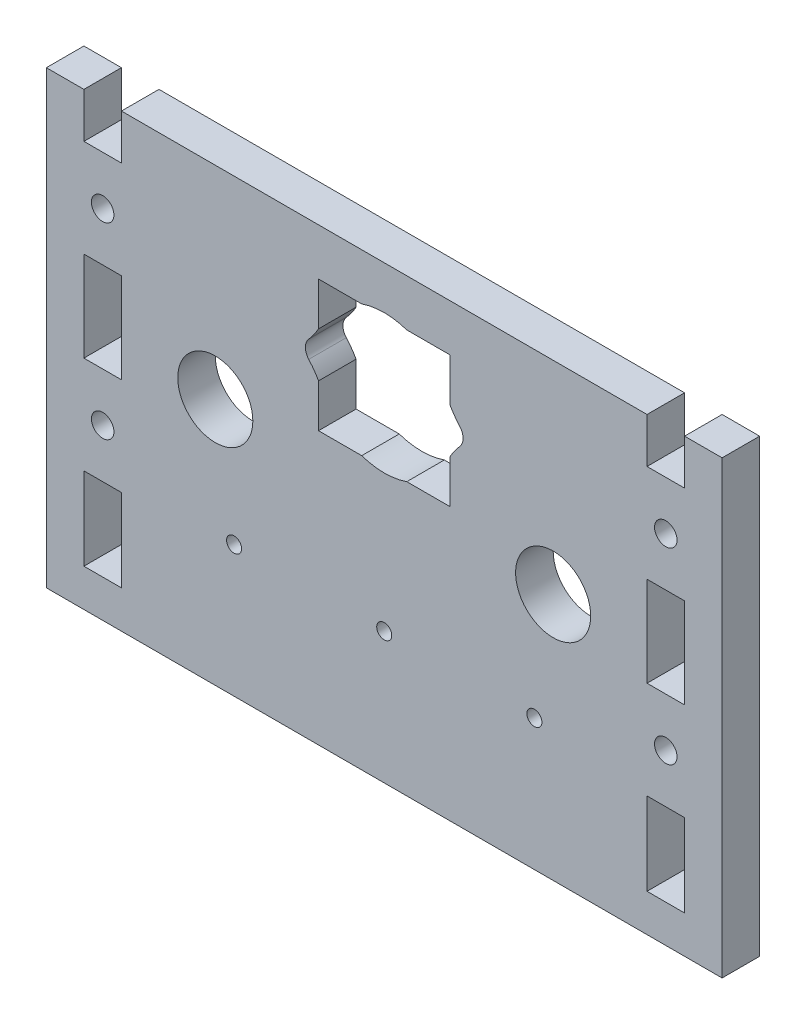
from build123d import *

# Parameters (mm, degrees)
SKETCH1_W           = 90
SKETCH1_H           = 60
BOSS_EXTRUDE1_DEPTH = 5
SKETCH3_R           = 9.25
CUT_EXTRUDE2_DEPTH  = 5
SKETCH4_W           = 17.5
SKETCH4_H           = 17.5
CUT_EXTRUDE3_DEPTH  = 5
SKETCH5_R           = 1.75
CUT_EXTRUDE4_DEPTH  = 5
SKETCH6_R           = 5
SKETCH6_R_2         = 1
CUT_EXTRUDE5_DEPTH  = 10
FILLET1_R           = 10
SKETCH7_W           = 5
SKETCH7_H           = 11
SKETCH7_H_2         = 12
SKETCH7_R           = 1.5
CUT_EXTRUDE6_DEPTH  = 5


with BuildPart() as part:
    # Sketch1 → Boss-Extrude1 (new body)
    with BuildSketch(Plane.XY):
        Rectangle(SKETCH1_W, SKETCH1_H)
    extrude(amount=BOSS_EXTRUDE1_DEPTH)

    # Sketch3 → Cut-Extrude2 (cut)
    with BuildSketch(Plane.XY.offset(5)):
        with Locations((0, 15)):
            Circle(SKETCH3_R)
    extrude(amount=-CUT_EXTRUDE2_DEPTH, mode=Mode.SUBTRACT)

    # Sketch4 → Cut-Extrude3 (cut)
    with BuildSketch(Plane.XY.offset(5)):
        with Locations((0, 15)):
            Rectangle(SKETCH4_W, SKETCH4_H)
    extrude(amount=-CUT_EXTRUDE3_DEPTH, mode=Mode.SUBTRACT)

    # Sketch5 → Cut-Extrude4 (cut)
    with BuildSketch(Plane.XY.offset(5)):
        with Locations((-8.75, 15)):
            Circle(SKETCH5_R)
        with Locations((8.75, 15)):
            Circle(SKETCH5_R)
    extrude(amount=-CUT_EXTRUDE4_DEPTH, mode=Mode.SUBTRACT)

    # Sketch6 → Cut-Extrude5 (cut)
    with BuildSketch(Plane.XY.offset(5)):
        with Locations((-22.5, 3)):
            Circle(SKETCH6_R)
        with Locations((22.5, 3)):
            Circle(SKETCH6_R)
        with Locations((-20, -12.5)):
            Circle(SKETCH6_R_2)
        with Locations((0, -12.5)):
            Circle(SKETCH6_R_2)
        with Locations((20, -12.5)):
            Circle(SKETCH6_R_2)
    extrude(amount=-CUT_EXTRUDE5_DEPTH, mode=Mode.SUBTRACT)

    # Fillet1
    # the kernel refuses this fillet: 10 mm, written as the material it takes off along each edge
    with BuildSketch(Plane(origin=(9.089285714, 13.283204962, -3.318254218), x_dir=(0.8690606948283255, 0.4947054767278286, 0), z_dir=(0, 0, 1))) as fillet1_piece_1:
        with BuildLine():
            CenterArc((4.277170512, -9.484831943), FILLET1_R, 108.471170307, 12.906966453)
            Line((-0.929668401, -0.947336494), (-1.033805179, -0.776586585))
            ThreePointArc((-1.033805179, -0.776586585), (-0.590566588, -0.350280804), (-0.152428823, 0.129481481))
            Line((-0.152428823, 0.129481481), (0.063365489, 0.189696639))
            ThreePointArc((0.063365489, 0.189696639), (0.554448029, 0.10984559), (1.04553057, 0.189696639))
            Line((1.04553057, 0.189696639), (1.108896059, 0))
        make_face()
    extrude(amount=11.636508437, mode=Mode.SUBTRACT)
    with BuildSketch(Plane(origin=(9.089285714, 16.716795038, -3.318254218), x_dir=(-0.255620645644957, 0.9667771643559105, 0), z_dir=(0, 0, 1))) as fillet1_piece_2:
        with BuildLine():
            CenterArc((3.77380457, -9.696113842), FILLET1_R, 104.1611678, 12.906966453)
            Line((-0.776692771, -0.791453605), (-0.867702718, -0.6133604))
            ThreePointArc((-0.867702718, -0.6133604), (-0.466746599, -0.318788775), (-0.179774835, 0.087641364))
            Line((-0.179774835, 0.087641364), (0.014349207, 0.199484586))
            ThreePointArc((0.014349207, 0.199484586), (0.663650844, 0.176162125), (1.27837163, 0.193922277))
            Line((1.27837163, 0.193922277), (1.327301687, 0))
        make_face()
    extrude(amount=11.636508437, mode=Mode.SUBTRACT)
    with BuildSketch(Plane(origin=(-9.089285714, 16.716795038, -3.318254218), x_dir=(0.25562064564495884, 0.9667771643559101, 0), z_dir=(0, 0, 1))) as fillet1_piece_3:
        with BuildLine():
            CenterArc((3.77380457, 9.696113842), FILLET1_R, 242.931865747, 12.906966453)
            Line((-0.776692771, 0.791453605), (-0.867702718, 0.6133604))
            ThreePointArc((-0.867702718, 0.6133604), (-0.466746599, 0.318788775), (-0.179774835, -0.087641364))
            Line((-0.179774835, -0.087641364), (0.014349207, -0.199484586))
            ThreePointArc((0.014349207, -0.199484586), (0.663650844, -0.176162125), (1.27837163, -0.193922277))
            Line((1.27837163, -0.193922277), (1.327301687, 0))
        make_face()
    extrude(amount=11.636508437, mode=Mode.SUBTRACT)
    with BuildSketch(Plane(origin=(-9.089285714, 13.283204962, -3.318254218), x_dir=(-0.8690606948283244, 0.4947054767278305, 0), z_dir=(0, 0, 1))) as fillet1_piece_4:
        with BuildLine():
            CenterArc((4.277170512, 9.484831943), FILLET1_R, 238.62186324, 12.906966453)
            Line((-0.929668401, 0.947336494), (-1.033805179, 0.776586585))
            ThreePointArc((-1.033805179, 0.776586585), (-0.590566588, 0.350280804), (-0.152428823, -0.129481481))
            Line((-0.152428823, -0.129481481), (0.063365489, -0.189696639))
            ThreePointArc((0.063365489, -0.189696639), (0.554448029, -0.10984559), (1.04553057, -0.189696639))
            Line((1.04553057, -0.189696639), (1.108896059, 0))
        make_face()
    extrude(amount=11.636508437, mode=Mode.SUBTRACT)

    # Sketch7 → Cut-Extrude6 (cut)
    with BuildSketch(Plane.XY.offset(5)):
        with Locations((-37.5, 29.5)):
            Rectangle(SKETCH7_W, SKETCH7_H)
        with Locations((-37.5, 5)):
            Rectangle(SKETCH7_W, SKETCH7_H_2)
        with Locations((-37.5, -19.5)):
            Rectangle(SKETCH7_W, SKETCH7_H)
        with Locations((-37.5, 17.5)):
            Circle(SKETCH7_R)
        with Locations((-37.5, -7.5)):
            Circle(SKETCH7_R)
    cut_extrude6 = extrude(amount=-CUT_EXTRUDE6_DEPTH, mode=Mode.SUBTRACT)

    # Mirror1: Cut-Extrude6 across plane
    add(cut_extrude6.mirror(Plane(origin=(0, 0, 0), x_dir=(0, 0, 1), z_dir=(1, 0, 0))), mode=Mode.SUBTRACT)


solid = part.part
